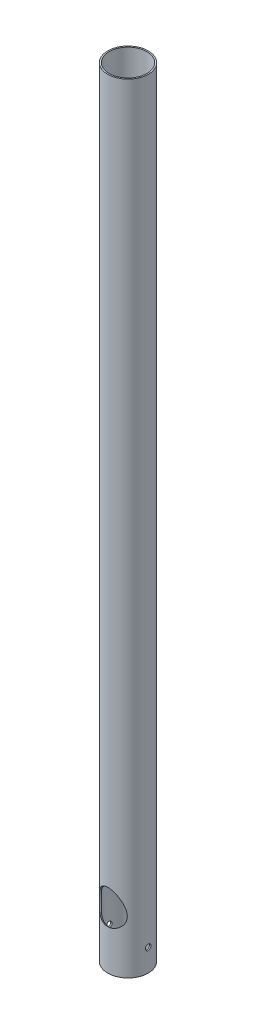
from build123d import *

# Parameters (mm, degrees)
EXTRUDE_1_OUTLINE_R      = 72.5
EXTRUDE_1_OUTLINE_R_2    = 67.5
EXTRUDE_1_DEPTH          = 2780
CUT_EXTRUDE_3_DEPTH      = 2782.890094882
CUT_EXTRUDE_3_DEPTH_BACK = 2782.890094882
SKETCH_6_R               = 10
SKETCH_7_R               = 50
CUT_EXTRUDE_4_DEPTH      = 200
SKETCH_13_R              = 52.5
CUT_EXTRUDE_8_DEPTH      = 200


# Read off the part's stored shape, not the designer's step: Вытянуть-Тонкостенный1
with BuildPart() as part:
    # Вытянуть-Тонкостенный1 outline → Вытянуть-Тонкостенный1 (new body)
    with BuildSketch(Plane(origin=(0, 0, 0), x_dir=(1, 0, 0), z_dir=(0, 1, 0))):
        Circle(EXTRUDE_1_OUTLINE_R)
        Circle(EXTRUDE_1_OUTLINE_R_2, mode=Mode.SUBTRACT)
    extrude(amount=EXTRUDE_1_DEPTH)

    # Эскиз6 → Вырез-Вытянуть3 (cut, two sides: drawn at the far end of the back side and taken through both)
    with BuildSketch(Plane(origin=(0, 0, 0), x_dir=(0, 0, -1), z_dir=(1, 0, 0)).offset(-CUT_EXTRUDE_3_DEPTH_BACK)):
        with Locations((0, 80)):
            Circle(SKETCH_6_R)
    extrude(amount=CUT_EXTRUDE_3_DEPTH + CUT_EXTRUDE_3_DEPTH_BACK, mode=Mode.SUBTRACT)

    # Эскиз7 → Вырез-Вытянуть4 (cut)
    with BuildSketch(Plane(origin=(0, 176.689515805, 252.338779809), x_dir=(1, 0, 0), z_dir=(0, -0.5735764363510416, -0.8191520442889949))):
        with Locations(Location((0, -126.118813858, 0), (0, 0, 90))):
            Circle(SKETCH_7_R)
    extrude(amount=CUT_EXTRUDE_4_DEPTH, mode=Mode.SUBTRACT)

    # Эскиз13 → Вырез-Вытянуть8 (cut)
    with BuildSketch(Plane(origin=(0, 750.265952156, 1071.490824098), x_dir=(1, 0, 0), z_dir=(0, -0.5735764363510416, -0.8191520442889949))):
        with Locations(Location((0, -2185, 0), (0, 0, 270))):
            Circle(SKETCH_13_R)
    extrude(amount=-CUT_EXTRUDE_8_DEPTH, mode=Mode.SUBTRACT)


solid = part.part
